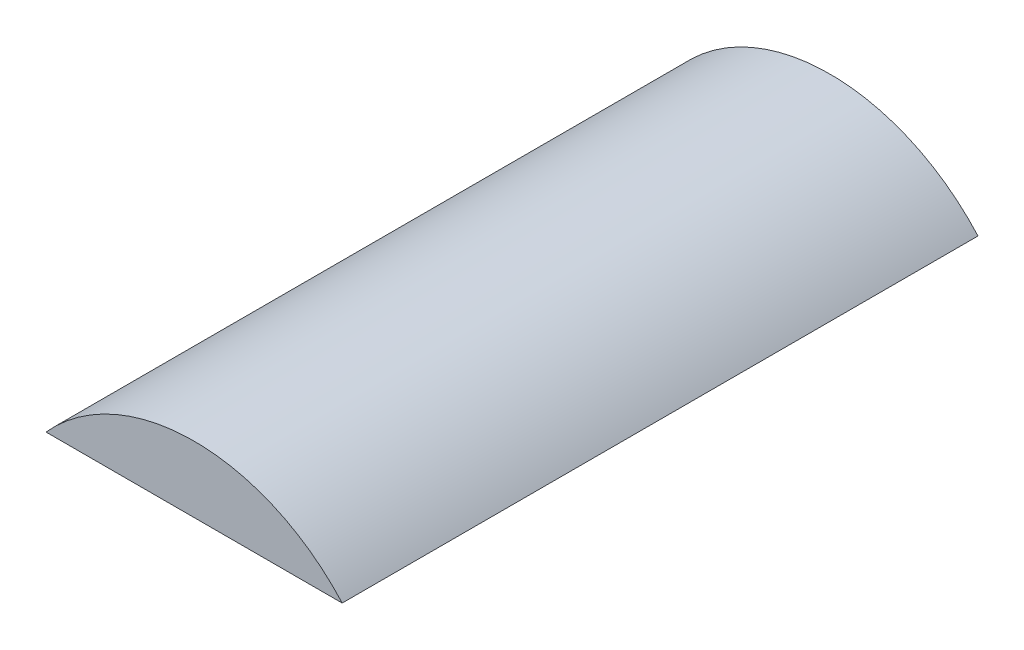
from build123d import *

# Parameters (mm, degrees)
BOSS_EXTRUDE1_DEPTH = 4.8


with BuildPart() as part:
    # Sketch1 → Boss-Extrude1 (new body)
    with BuildSketch(Plane.XY):
        with BuildLine():
            ThreePointArc((1.118033989, 1), (0, 1.5), (-1.118033989, 1))
            Line((-1.118033989, 1), (1.118033989, 1))
        make_face()
    extrude(amount=-BOSS_EXTRUDE1_DEPTH)


solid = part.part
